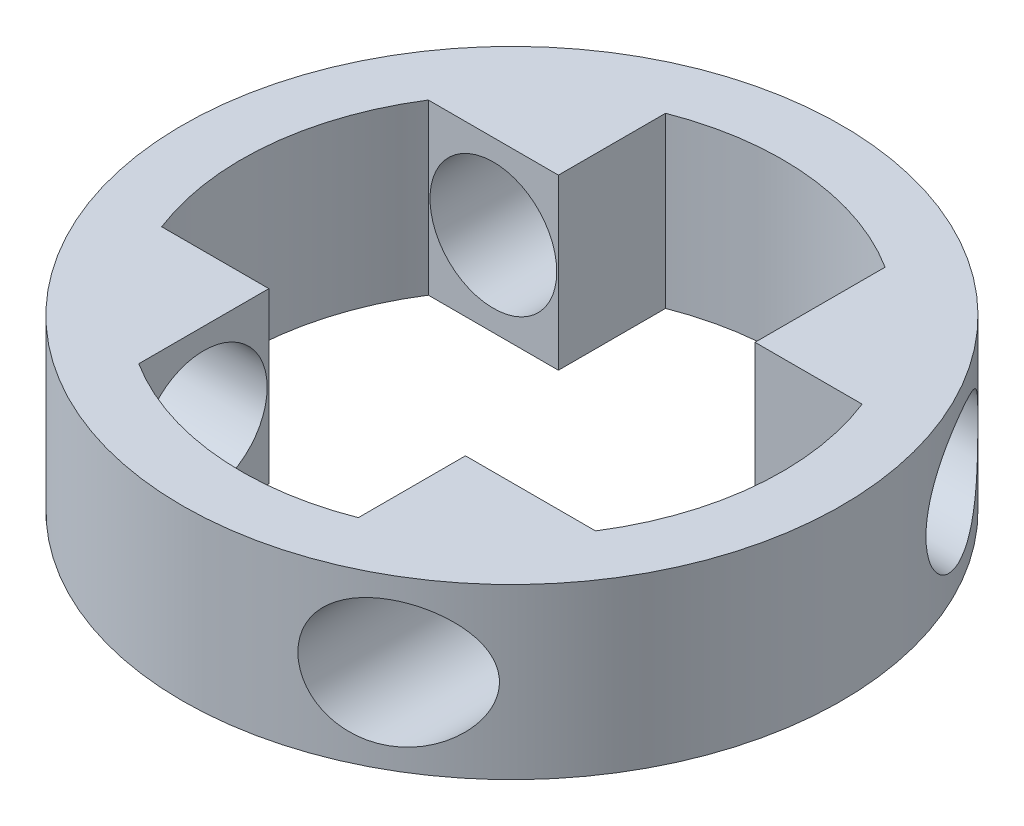
from build123d import *

# Parameters (mm, degrees)
SKETCH1_R           = 49.53
SKETCH1_R_2         = 40.64
BOSS_EXTRUDE1_DEPTH = 12.7
BOSS_EXTRUDE2_DEPTH = 12.7
SKETCH3_R           = 9.525
CUT_EXTRUDE1_DEPTH  = 88.729988813
CIRPATTERN1_COUNT   = 4


with BuildPart() as part:
    # Sketch1 → Boss-Extrude1 (new, symmetric)
    with BuildSketch(Plane(origin=(0, 0, 0), x_dir=(1, 0, 0), z_dir=(0, 1, 0))):
        Circle(SKETCH1_R)
        Circle(SKETCH1_R_2, mode=Mode.SUBTRACT)
    extrude(amount=BOSS_EXTRUDE1_DEPTH, both=True)

    # Sketch2 → Boss-Extrude2 (add, symmetric)
    with BuildSketch(Plane(origin=(0, 0, 0), x_dir=(1, 0, 0), z_dir=(0, 1, 0))):
        with BuildLine():
            Line((43.786890952, -21.758428384), (14.773428494, -21.758428384))
            Line((14.773428494, -21.758428384), (14.773428494, -43.348428384))
            Line((14.773428494, -43.348428384), (22.619345296, -43.348428384))
            ThreePointArc((22.619345296, -43.348428384), (34.913880881, -34.230716423), (43.786890952, -21.758428384))
        make_face()
        with BuildLine():
            Line((-21.758428494, -43.786890898), (-21.758428494, -14.773428384))
            Line((-21.758428494, -14.773428384), (-43.348428494, -14.773428384))
            Line((-43.348428494, -14.773428384), (-43.348428494, -22.619345087))
            ThreePointArc((-43.348428494, -22.619345087), (-34.230716551, -34.913880755), (-21.758428494, -43.786890898))
        make_face()
        with BuildLine():
            Line((21.758428494, 14.773428384), (43.348428494, 14.773428384))
            Line((43.348428494, 14.773428384), (43.348428494, 22.619345087))
            ThreePointArc((43.348428494, 22.619345087), (34.230716551, 34.913880755), (21.758428494, 43.786890898))
            Line((21.758428494, 43.786890898), (21.758428494, 14.773428384))
        make_face()
        with BuildLine():
            Line((-43.786890952, 21.758428384), (-14.773428494, 21.758428384))
            Line((-14.773428494, 21.758428384), (-14.773428494, 43.348428384))
            Line((-14.773428494, 43.348428384), (-22.619345296, 43.348428384))
            ThreePointArc((-22.619345296, 43.348428384), (-34.913880881, 34.230716423), (-43.786890952, 21.758428384))
        make_face()
    extrude(amount=BOSS_EXTRUDE2_DEPTH, both=True)

    # Sketch3 → Cut-Extrude1 (cut, through all)
    with BuildSketch(Plane(origin=(-21.758428494, 0, 0), x_dir=(0, 0, -1), z_dir=(1, 0, 0))):
        with Locations((-24.549030393, 0)):
            Circle(SKETCH3_R)
    cut_extrude1 = extrude(amount=-CUT_EXTRUDE1_DEPTH, mode=Mode.SUBTRACT)

    # CirPattern1: Cut-Extrude1 ×4 about axis
    cirpattern1_axis = Axis((0, 12.7, 0), (0, 1, 0))
    for i in range(1, CIRPATTERN1_COUNT):
        add(cut_extrude1.rotate(cirpattern1_axis, i * 360 / CIRPATTERN1_COUNT), mode=Mode.SUBTRACT)


solid = part.part
